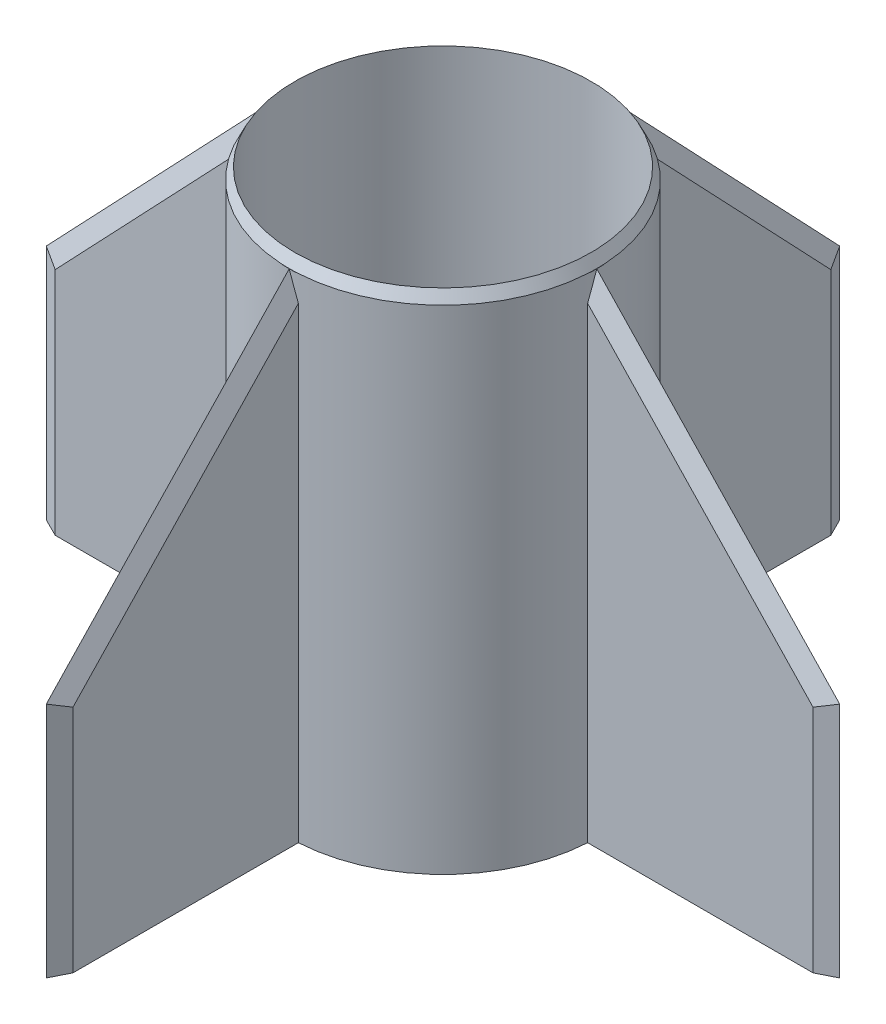
from build123d import *

# Parameters (mm, degrees)
SKETCH1_R                                     = 35.27
SKETCH1_R_2                                   = 34
BOSS_EXTRUDE1_DEPTH                           = 115.6
SKETCH3_W                                     = 4.08
SKETCH3_H                                     = 113.06
BOSS_EXTRUDE2_DEPTH                           = 90.984
CUT_EXTRUDE1_DEPTH                            = 152.767863384
CUT_EXTRUDE4_DEPTH                            = 152.279281979
MIRROR4_AT_THE_SECOND_PLANE_COPY_1_DEPTH      = 152.279281979
CUT_EXTRUDE5_REACH                            = 175.905
CUT_EXTRUDE5_END_RADIUS                       = 35.27
MIRROR5_AT_THE_SECOND_PLANE_COPY_1_REACH      = 175.905
MIRROR5_AT_THE_SECOND_PLANE_COPY_1_END_RADIUS = 35.27
SKETCH12_W                                    = 4.08
SKETCH12_H                                    = 113.06
BOSS_EXTRUDE3_DEPTH                           = 90.984
CUT_EXTRUDE6_DEPTH                            = 175.054338734
CUT_EXTRUDE7_DEPTH                            = 173.972646716
MIRROR6_START                                 = -1
MIRROR6_DEPTH                                 = 114.06
MIRROR6_START_2                               = -2.04
MIRROR6_2_DEPTH                               = 4.08
MIRROR6_START_3                               = 40.689281773
MIRROR6_3_OUTLINE_W                           = 8
MIRROR6_3_OUTLINE_H                           = 61
MIRROR6_3_DEPTH                               = 3.310718227
CUT_EXTRUDE8_REACH                            = 195.073
CUT_EXTRUDE8_END_RADIUS                       = 35.27
MIRROR7_AT_THE_SECOND_PLANE_COPY_1_REACH      = 195.073
MIRROR7_AT_THE_SECOND_PLANE_COPY_1_END_RADIUS = 35.27
CUT_EXTRUDE9_DEPTH                            = 173.972646716
CUT_EXTRUDE9_DEPTH_BACK                       = 173.972646716
SKETCH17_R                                    = 34
SCALE2_SCALE                                  = 0.985294118


with BuildPart() as part:
    # Sketch1 → Boss-Extrude1 (new body)
    with BuildSketch(Plane(origin=(0, 0, 0), x_dir=(1, 0, 0), z_dir=(0, 1, 0))):
        with Locations(Location((0, 0, 0), (0, 0, 270))):
            Circle(SKETCH1_R)
        with Locations(Location((0, 0, 0), (0, 0, 270))):
            Circle(SKETCH1_R_2, mode=Mode.SUBTRACT)
    extrude(amount=BOSS_EXTRUDE1_DEPTH)

    # Sketch2 → Cut-Revolve3 (revolve, cut)
    with BuildSketch(Plane(origin=(0, 0, 0), x_dir=(0, 0, -1), z_dir=(1, 0, 0))):
        Polygon((-35.27, 113.06), (-35.27, 115.6), (-34, 115.6), align=None)
    revolve(axis=Axis((0, 115.6, 0), (0, -1, 0)), mode=Mode.SUBTRACT)

    # Sketch3 → Boss-Extrude2 (add, symmetric)
    with BuildSketch(Plane.XY):
        with Locations((0, 56.53)):
            Rectangle(SKETCH3_W, SKETCH3_H)
    extrude(amount=BOSS_EXTRUDE2_DEPTH, both=True)

    # Sketch4 → Cut-Extrude1 (cut, symmetric)
    with BuildSketch(Plane.ZY.offset(2.04)):
        Polygon((35.210954261, 113.06), (90.984, 54.4), (90.984, 113.06), align=None)
    cut_extrude1 = extrude(amount=CUT_EXTRUDE1_DEPTH, both=True, mode=Mode.SUBTRACT)

    # Mirror3: Cut-Extrude1 across plane
    add(cut_extrude1.mirror(Plane.XY), mode=Mode.SUBTRACT)

    # Sketch7 → Cut-Extrude4 (cut, symmetric)
    with BuildSketch(Plane.XZ):
        Polygon((0, 90.984), (-2.04, 86.904), (-2.04, 90.984), align=None)
    cut_extrude4 = extrude(amount=CUT_EXTRUDE4_DEPTH, both=True, mode=Mode.SUBTRACT)

    # Mirror4: Cut-Extrude4 across plane
    add(cut_extrude4.mirror(Plane(origin=(0, 0, 0), x_dir=(0, 0, 1), z_dir=(1, 0, 0))), mode=Mode.SUBTRACT)

    # Mirror4 at the second plane: Cut-Extrude4 across plane
    add(cut_extrude4.mirror(Plane.XY), mode=Mode.SUBTRACT)

    # Mirror4 at the second plane copy 1 sketc → Mirror4 at the second plane copy 1 (cut, symmetric)
    with BuildSketch(Plane(origin=(0, 0, 0), x_dir=(-1, 0, 0), z_dir=(0, -1, 0))):
        Polygon((0, 90.984), (-2.04, 86.904), (-2.04, 90.984), align=None)
    extrude(amount=MIRROR4_AT_THE_SECOND_PLANE_COPY_1_DEPTH, both=True, mode=Mode.SUBTRACT)

    # Cut-Extrude5: up to this cylinder (the profile starts outside it)
    cut_extrude5_end = Plane(origin=(0, 53.462894, 0), z_dir=(0, -1, 0)) * Cylinder(CUT_EXTRUDE5_END_RADIUS, 423.35, mode=Mode.PRIVATE)
    # Sketch11 → Cut-Extrude5 (cut, up to the surface)
    with BuildSketch(Plane(origin=(0, -16.862580362, -16.032687791), x_dir=(1, 0, 0), z_dir=(0, 0.7247153095275539, 0.6890484163949453)), mode=Mode.PRIVATE) as cut_extrude5_sk1:
        Polygon((0, 103.421731574), (-2.04, 103.421731574), (-2.04, 99.341731574), align=None)
    cut_extrude5_tool1 = extrude(cut_extrude5_sk1.sketch, amount=CUT_EXTRUDE5_REACH, mode=Mode.PRIVATE) - cut_extrude5_end
    cut_extrude5 = cut_extrude5_tool1.solids().sort_by_distance((-1.36, 53.462894, -89.998387))[0]
    add(cut_extrude5, mode=Mode.SUBTRACT)

    # Mirror5: Cut-Extrude5 across plane
    add(cut_extrude5.mirror(Plane(origin=(0, 0, 0), x_dir=(0, 0, 1), z_dir=(1, 0, 0))), mode=Mode.SUBTRACT)

    # Mirror5 at the second plane: Cut-Extrude5 across plane
    add(cut_extrude5.mirror(Plane.XY), mode=Mode.SUBTRACT)

    # Mirror5 at the second plane copy 1: up to this cylinder (the profile starts outside it)
    mirror5_at_the_second_plane_copy_1_end = Plane(origin=(0, 53.462894, 0), z_dir=(0, -1, 0)) * Cylinder(MIRROR5_AT_THE_SECOND_PLANE_COPY_1_END_RADIUS, 423.35, mode=Mode.PRIVATE)
    # Mirror5 at the second plane copy 1 sketc → Mirror5 at the second plane copy 1 (cut, up to the surface)
    with BuildSketch(Plane(origin=(0, -16.862580362, 16.032687791), x_dir=(-1, 0, 0), z_dir=(0, 0.7247153095275539, -0.6890484163949453)), mode=Mode.PRIVATE) as mirror5_at_the_second_plane_copy_1_sk1:
        Polygon((0, 103.421731574), (-2.04, 103.421731574), (-2.04, 99.341731574), align=None)
    mirror5_at_the_second_plane_copy_1_tool1 = extrude(mirror5_at_the_second_plane_copy_1_sk1.sketch, amount=MIRROR5_AT_THE_SECOND_PLANE_COPY_1_REACH, mode=Mode.PRIVATE) - mirror5_at_the_second_plane_copy_1_end
    add(mirror5_at_the_second_plane_copy_1_tool1.solids().sort_by_distance((-1.36, 53.462894, -89.998387))[0], mode=Mode.SUBTRACT)

    # Sketch12 → Boss-Extrude3 (add, symmetric)
    with BuildSketch(Plane(origin=(0, 0, 0), x_dir=(0, 0, -1), z_dir=(1, 0, 0))):
        with Locations((0, 56.53)):
            Rectangle(SKETCH12_W, SKETCH12_H)
    extrude(amount=BOSS_EXTRUDE3_DEPTH, both=True)

    # Sketch13 → Cut-Extrude6 (cut, through all)
    with BuildSketch(Plane.XY.offset(2.04)):
        Polygon((35.210954261, 113.06), (90.984, 113.06), (90.984, 54.4), align=None)
    extrude(amount=-CUT_EXTRUDE6_DEPTH, mode=Mode.SUBTRACT)

    # Sketch14 → Cut-Extrude7 (cut, through all)
    with BuildSketch(Plane.XZ):
        Polygon((90.984, 0), (90.984, 2.04), (86.904, 2.04), align=None)
    extrude(amount=-CUT_EXTRUDE7_DEPTH, mode=Mode.SUBTRACT)

    # Mirror6: read off the stored shape, not the designer's step
    # Mirror6 outline → Mirror6 (cut)
    with BuildSketch(Plane(origin=(0, 0, 0), x_dir=(1, 0, 0), z_dir=(0, 1, 0)).offset(MIRROR6_START)):
        Polygon((-90.984, 2.04), (-90.984, 0), (-86.904, 2.04), align=None)
        Polygon((-86.904, -2.04), (-90.984, 0), (-90.984, -2.04), align=None)
    extrude(amount=MIRROR6_DEPTH, mode=Mode.SUBTRACT)

    # Mirror6 2 outline → Mirror6 2 (cut)
    with BuildSketch(Plane.XY.offset(MIRROR6_START_2)):
        Polygon((-90.984, 54.4), (-35.210954261, 113.06), (-92, 113.06), (-92, 53.331409264), align=None)
    extrude(amount=MIRROR6_2_DEPTH, mode=Mode.SUBTRACT)

    # Mirror6 3 outline → Mirror6 3 (cut)
    with BuildSketch(Plane(origin=(0, 0, 0), x_dir=(0.8944271909999159, 0, 0.44721359549995804), z_dir=(0.447213595499958, 0, -0.894427190999916)).offset(MIRROR6_START_3)):
        with Locations((79, -29.5)):
            Rectangle(MIRROR6_3_OUTLINE_W, MIRROR6_3_OUTLINE_H)
    extrude(amount=MIRROR6_3_DEPTH, mode=Mode.SUBTRACT)

    # Cut-Extrude8: up to this cylinder (the profile starts outside it)
    cut_extrude8_end = Plane(origin=(0, 53.462894, 0), z_dir=(0, -1, 0)) * Cylinder(CUT_EXTRUDE8_END_RADIUS, 461.686, mode=Mode.PRIVATE)
    # Sketch15 → Cut-Extrude8 (cut, up to the surface)
    with BuildSketch(Plane(origin=(16.032687791, -16.862580362, 0), x_dir=(0.7247153095275543, 0.6890484163949449, 0), z_dir=(-0.6890484163949449, 0.7247153095275543, 0)), mode=Mode.PRIVATE) as cut_extrude8_sk1:
        Polygon((103.421731574, 0), (103.421731574, 2.04), (99.341731574, 2.04), align=None)
    cut_extrude8_tool1 = extrude(cut_extrude8_sk1.sketch, amount=CUT_EXTRUDE8_REACH, mode=Mode.PRIVATE) - cut_extrude8_end
    cut_extrude8 = cut_extrude8_tool1.solids().sort_by_distance((89.998387, 53.462894, -1.36))[0]
    add(cut_extrude8, mode=Mode.SUBTRACT)

    # Mirror7: Cut-Extrude8 across plane
    add(cut_extrude8.mirror(Plane(origin=(0, 0, 0), x_dir=(0, 0, 1), z_dir=(1, 0, 0))), mode=Mode.SUBTRACT)

    # Mirror7 at the second plane: Cut-Extrude8 across plane
    add(cut_extrude8.mirror(Plane.XY), mode=Mode.SUBTRACT)

    # Mirror7 at the second plane copy 1: up to this cylinder (the profile starts outside it)
    mirror7_at_the_second_plane_copy_1_end = Plane(origin=(0, 53.462894, 0), z_dir=(0, -1, 0)) * Cylinder(MIRROR7_AT_THE_SECOND_PLANE_COPY_1_END_RADIUS, 461.686, mode=Mode.PRIVATE)
    # Mirror7 at the second plane copy 1 sketc → Mirror7 at the second plane copy 1 (cut, up to the surface)
    with BuildSketch(Plane(origin=(-16.032687791, -16.862580362, 0), x_dir=(-0.7247153095275543, 0.6890484163949449, 0), z_dir=(0.6890484163949449, 0.7247153095275543, 0)), mode=Mode.PRIVATE) as mirror7_at_the_second_plane_copy_1_sk1:
        Polygon((103.421731574, 0), (103.421731574, 2.04), (99.341731574, 2.04), align=None)
    mirror7_at_the_second_plane_copy_1_tool1 = extrude(mirror7_at_the_second_plane_copy_1_sk1.sketch, amount=MIRROR7_AT_THE_SECOND_PLANE_COPY_1_REACH, mode=Mode.PRIVATE) - mirror7_at_the_second_plane_copy_1_end
    add(mirror7_at_the_second_plane_copy_1_tool1.solids().sort_by_distance((89.998387, 53.462894, -1.36))[0], mode=Mode.SUBTRACT)

    # Sketch17 → Cut-Extrude9 (cut, two sides: drawn at the far end of the back side and taken through both)
    with BuildSketch(Plane.XZ.offset(-CUT_EXTRUDE9_DEPTH_BACK)):
        with Locations(Location((0, 0, 0), (0, 0, 90))):
            Circle(SKETCH17_R)
    extrude(amount=CUT_EXTRUDE9_DEPTH + CUT_EXTRUDE9_DEPTH_BACK, mode=Mode.SUBTRACT)


with BuildPart() as part_1:
    # Scale2: scaled about (0, 47.022865963, 0)
    add(part.part.scale(SCALE2_SCALE).moved(Location((0, 0.691512735, 0))))


solid = part_1.part
